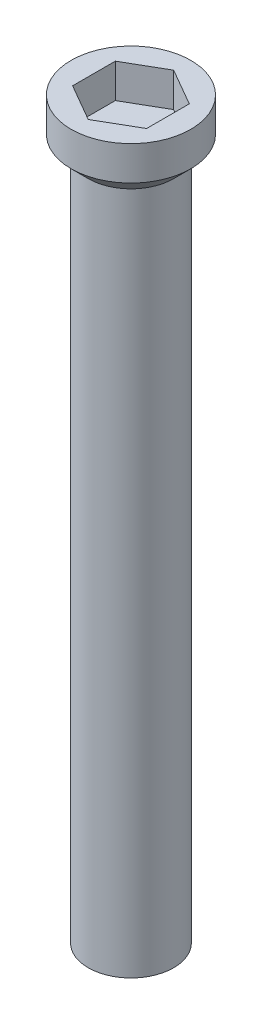
from build123d import *

# Parameters (mm, degrees)
SKETCH1_R          = 2.5
SCREW_LENGTH_DEPTH = 40
SKETCH2_R          = 3.5
SCREW_CAP_DEPTH    = 3
SCREW_HOLE_DEPTH   = 2
CHAMFER1_SIZE      = 1


with BuildPart() as part:
    # Sketch1 → Screw Length (new body)
    with BuildSketch(Plane(origin=(0, 0, 0), x_dir=(1, 0, 0), z_dir=(0, 1, 0))):
        with Locations(Location((0, 0, 0), (0, 0, 270))):
            Circle(SKETCH1_R)
    extrude(amount=SCREW_LENGTH_DEPTH)

    # Sketch2 → Screw Cap (add)
    with BuildSketch(Plane(origin=(0, 40, 0), x_dir=(1, 0, 0), z_dir=(0, 1, 0))):
        with Locations(Location((0, 0, 0), (0, 0, 270))):
            Circle(SKETCH2_R)
    extrude(amount=SCREW_CAP_DEPTH)

    # Sketch3 → Screw Hole (cut)
    with BuildSketch(Plane(origin=(0, 43, 0), x_dir=(1, 0, 0), z_dir=(0, 1, 0))):
        Polygon((0, 2.5), (-2.165063509, 1.25), (-2.165063509, -1.25), (0, -2.5), (2.165063509, -1.25), (2.165063509, 1.25), align=None)
    extrude(amount=-SCREW_HOLE_DEPTH, mode=Mode.SUBTRACT)

    # Chamfer1
    chamfer1_edges = [part.edges().sort_by_distance(p)[0] for p in [
        (0, 40, -3.5),
    ]]
    chamfer(chamfer1_edges, length=CHAMFER1_SIZE - 0.0001)  # a hair under: the kernel refuses the full size


solid = part.part
